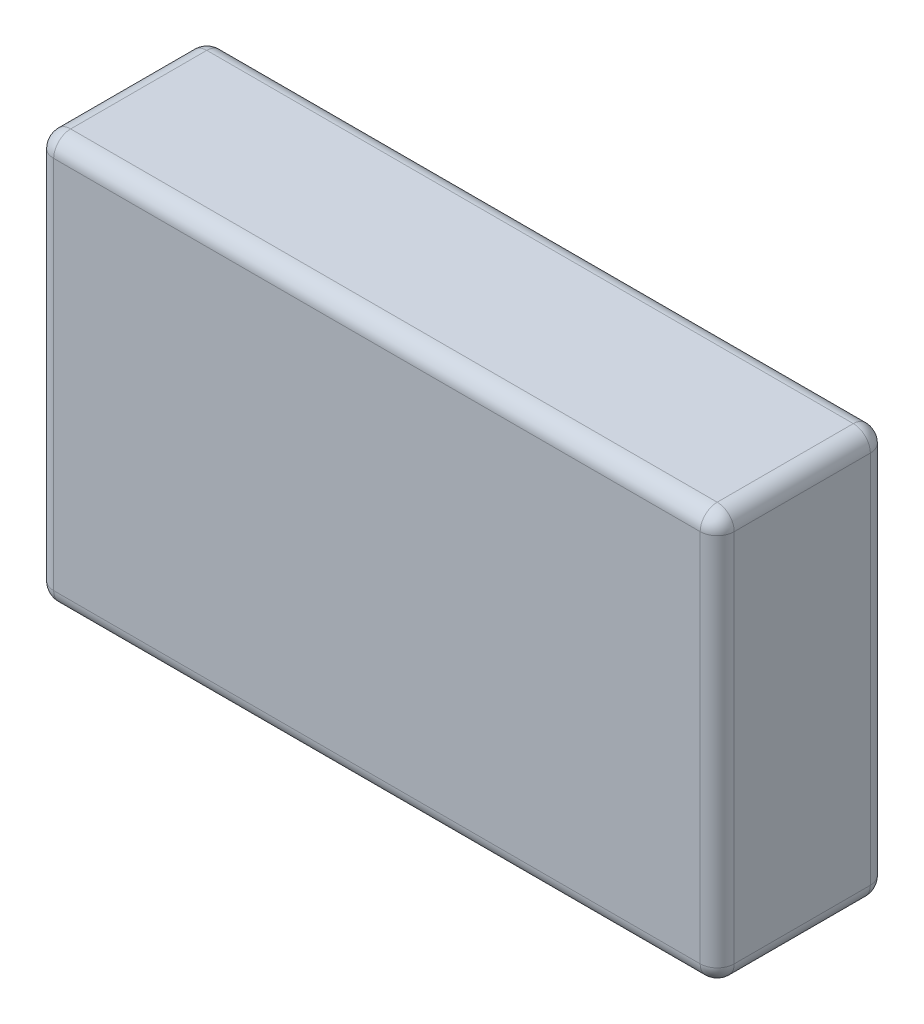
from build123d import *

# Parameters (mm, degrees)
SKETCH_1_W      = 20
SKETCH_1_H      = 12
EXTRUDE_1_DEPTH = 5
FILLET_1_R      = 0.5


with BuildPart() as part:
    # ｽｹｯﾁ1 → ﾎﾞｽ - 押し出し1 (new body)
    with BuildSketch(Plane.XY):
        Rectangle(SKETCH_1_W, SKETCH_1_H)
    extrude(amount=EXTRUDE_1_DEPTH)

    # ﾌｨﾚｯﾄ1
    fillet_1_edges = [part.edges().sort_by_distance(p)[0] for p in [
        (0, 6, 0),
        (-10, 0, 0),
        (0, -6, 0),
        (10, 0, 0),
        (0, -6, 5),
        (-10, 0, 5),
        (0, 6, 5),
        (10, 0, 5),
        (-10, -6, 2.5),
        (10, -6, 2.5),
        (10, 6, 2.5),
        (-10, 6, 2.5),
    ]]
    fillet(fillet_1_edges, radius=FILLET_1_R)


solid = part.part
